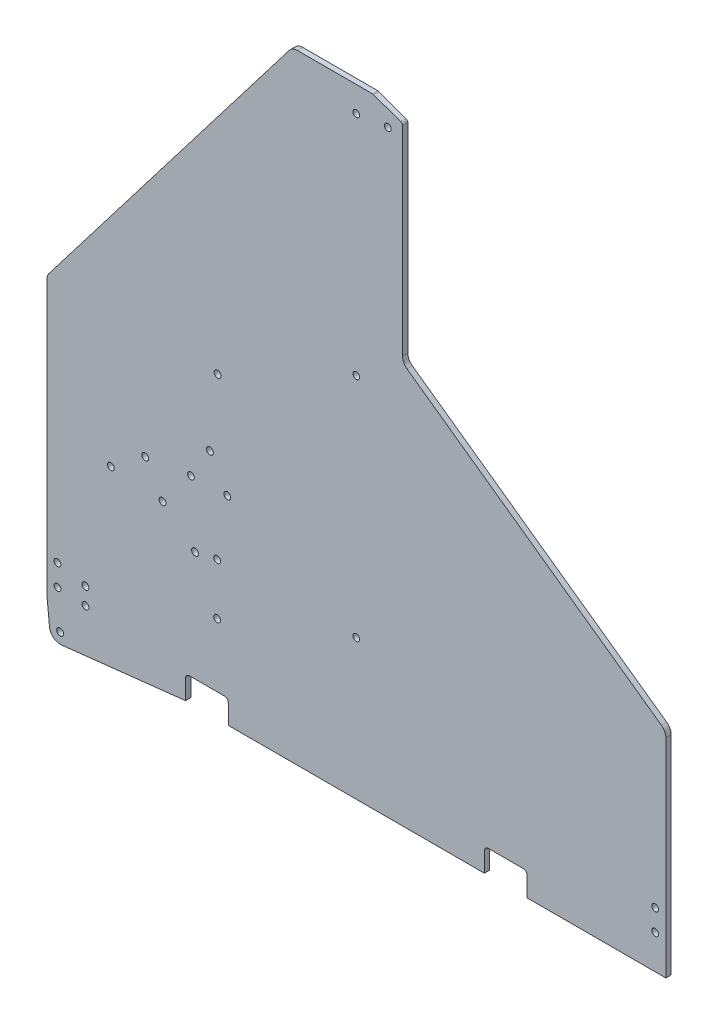
from build123d import *

# Parameters (mm, degrees)
SKETCH1_R           = 2.032
SKETCH1_R_2         = 2
BOSS_EXTRUDE1_DEPTH = 3.175
FILLET1_R           = 2.286
FILLET2_R           = 6.35
SKETCH2_R           = 2.032
CUT_EXTRUDE1_DEPTH  = 507.700158896
FILLET3_R           = 1.5875


with BuildPart() as part:
    # Sketch1 → Boss-Extrude1 (new body)
    with BuildSketch(Plane.XY):
        with BuildLine():
            Line((8.639060666, -28.536126099), (82.55, -20.32))
            Line((82.55, -20.32), (82.55, -6.35))
            Line((82.55, -6.35), (107.95, -6.35))
            Line((107.95, -6.35), (107.95, -20.32))
            Line((107.95, -20.32), (260.35, -20.32))
            Line((260.35, -20.32), (260.35, -6.35))
            Line((260.35, -6.35), (285.75, -6.35))
            Line((285.75, -6.35), (285.75, -20.32))
            Line((285.75, -20.32), (368.3, -20.32))
            Line((368.3, -20.32), (368.3, 106.68))
            Line((368.3, 106.68), (211.61375, 218.44))
            Line((211.61375, 218.44), (211.61375, 341.63))
            Line((211.61375, 341.63), (194.14998, 347.98))
            Line((194.14998, 347.98), (184.15, 347.98))
            Line((184.15, 347.98), (146.05, 347.98))
            Line((146.05, 347.98), (0, 157.48))
            Line((0, 157.48), (0, 0))
            Line((0, 0), (0, -6.35))
            ThreePointArc((0, -6.35), (0.007883354, -6.666317007), (0.031513842, -6.981848616))
            Line((0.031513842, -6.981848616), (1.619013842, -22.856848616))
            ThreePointArc((1.619013842, -22.856848616), (3.943628298, -27.161748811), (8.639060666, -28.536126099))
        make_face()
        with Locations((7.9375, -22.225)):
            Circle(SKETCH1_R, mode=Mode.SUBTRACT)
        with Locations((6.35, 0)):
            Circle(SKETCH1_R, mode=Mode.SUBTRACT)
        with Locations((6.35, 12.7)):
            Circle(SKETCH1_R, mode=Mode.SUBTRACT)
        with Locations((88.216909404, 59.136578314)):
            Circle(SKETCH1_R, mode=Mode.SUBTRACT)
        with Locations((184.15, 62.98)):
            Circle(SKETCH1_R_2, mode=Mode.SUBTRACT)
        with Locations((38.1, 78.105)):
            Circle(SKETCH1_R, mode=Mode.SUBTRACT)
        with Locations((68.887329744, 75.518700365)):
            Circle(SKETCH1_R, mode=Mode.SUBTRACT)
        with Locations((58.568579744, 93.391299635)):
            Circle(SKETCH1_R, mode=Mode.SUBTRACT)
        with Locations((85.725, 97.155)):
            Circle(SKETCH1_R, mode=Mode.SUBTRACT)
        with Locations((107.382158942, 97.743700365)):
            Circle(SKETCH1_R, mode=Mode.SUBTRACT)
        with Locations((97.063408942, 115.616299635)):
            Circle(SKETCH1_R, mode=Mode.SUBTRACT)
        with Locations((101.6, 157.48)):
            Circle(SKETCH1_R, mode=Mode.SUBTRACT)
        with Locations((361.95, 0)):
            Circle(SKETCH1_R, mode=Mode.SUBTRACT)
        with Locations((361.95, 12.7)):
            Circle(SKETCH1_R, mode=Mode.SUBTRACT)
        with Locations((184.15, 197.98)):
            Circle(SKETCH1_R_2, mode=Mode.SUBTRACT)
        with Locations((184.15, 332.98)):
            Circle(SKETCH1_R_2, mode=Mode.SUBTRACT)
        with Locations((202.881865, 335.28)):
            Circle(SKETCH1_R_2, mode=Mode.SUBTRACT)
    extrude(amount=BOSS_EXTRUDE1_DEPTH)

    # Fillet1
    fillet1_edges = [part.edges().sort_by_distance(p)[0] for p in [
        (285.75, -6.35, 1.5875),
        (107.95, -6.35, 1.5875),
        (260.35, -6.35, 1.5875),
        (82.55, -6.35, 1.5875),
    ]]
    fillet(fillet1_edges, radius=FILLET1_R)

    # Fillet2
    fillet2_edges = [part.edges().sort_by_distance(p)[0] for p in [
        (0, 157.48, 1.5875),
        (211.61375, 218.44, 1.5875),
        (368.3, 106.68, 1.5875),
        (146.05, 347.98, 1.5875),
    ]]
    fillet(fillet2_edges, radius=FILLET2_R)

    # Sketch2 → Cut-Extrude1 (cut, through all)
    with BuildSketch(Plane(origin=(0, 0, 0), x_dir=(-1, 0, 0), z_dir=(0, 0, -1))):
        with Locations((-101.339768613, 61.847479268)):
            Circle(SKETCH2_R)
        with Locations((-101.339768613, 31.367479268)):
            Circle(SKETCH2_R)
        with Locations((-23.011998341, 8.96398506)):
            Circle(SKETCH2_R)
        with Locations((-23.011998341, -1.19601494)):
            Circle(SKETCH2_R)
    extrude(amount=-CUT_EXTRUDE1_DEPTH, mode=Mode.SUBTRACT)

    # Fillet3
    fillet3_edges = [part.edges().sort_by_distance(p)[0] for p in [
        (211.61375, 341.63, 1.5875),
        (194.14998, 347.98, 1.5875),
    ]]
    fillet(fillet3_edges, radius=FILLET3_R)


solid = part.part
